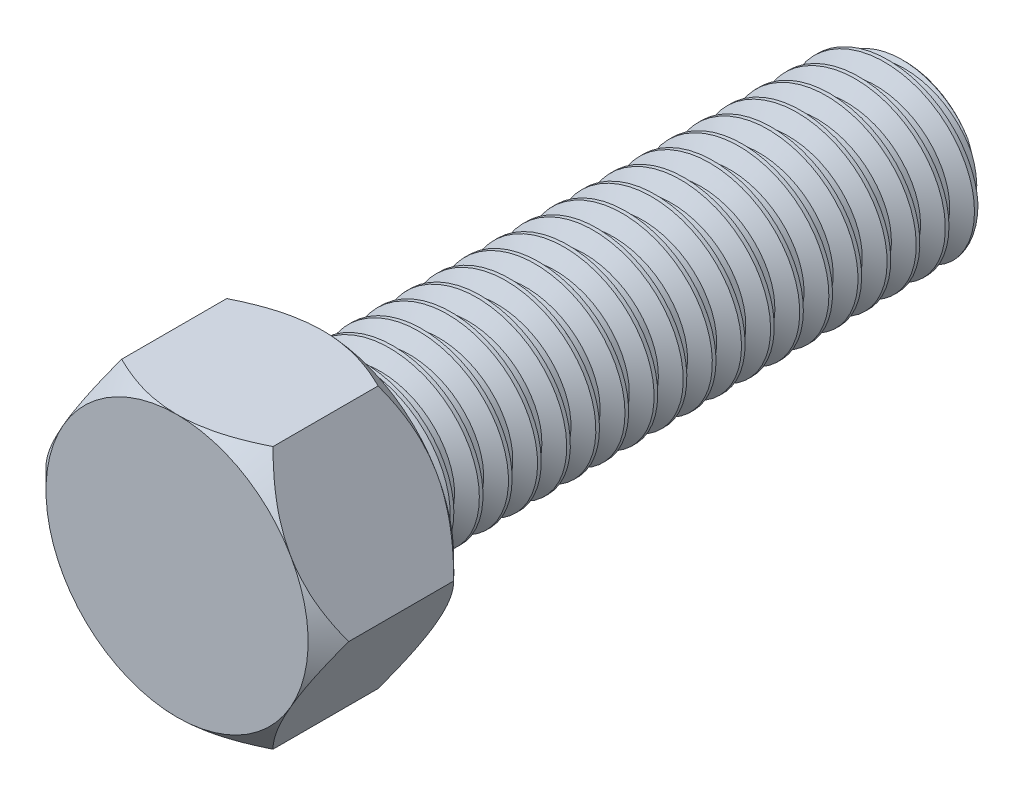
from build123d import *
from build123d.topology import SkipClean

# Parameters (mm, degrees)
BOSS_EXTRUDE1_DEPTH     = 2.5
SKETCH2_OUTSIDE_W       = 34.318
SKETCH2_OUTSIDE_H       = 32.926
SKETCH2_OUTSIDE_R       = 4.5
CUT_EXTRUDE1_DEPTH      = 9.5
CUT_EXTRUDE1_DRAFT      = -45
MIRROR1_COPY_1_SKETCH_W = 34.318
MIRROR1_COPY_1_SKETCH_H = 32.926
MIRROR1_COPY_1_SKETCH_R = 4.5
MIRROR1_COPY_1_DEPTH    = 9.5
MIRROR1_COPY_1_DRAFT    = -45
SKETCH3_R               = 3
BOSS_EXTRUDE2_DEPTH     = 20
CHAMFER1_SIZE           = 0.5
THREAD1_PITCH           = 1
CUT_EXTRUDE2_DEPTH      = 24.526580827


with BuildPart() as part:
    # Sketch1 → Boss-Extrude1 (new, symmetric)
    with BuildSketch(Plane.XY):
        Polygon((2.598076211, 4.5), (-2.598076211, 4.5), (-5.196152423, 0), (-2.598076211, -4.5), (2.598076211, -4.5), (5.196152423, 0), align=None)
    extrude(amount=BOSS_EXTRUDE1_DEPTH, both=True)


with BuildPart() as cut_extrude1_tool:
    # Sketch2 outside → Cut-Extrude1 (with draft: the straight prism first)
    with BuildSketch(Plane.XY.offset(2.5)):
        Rectangle(SKETCH2_OUTSIDE_W, SKETCH2_OUTSIDE_H)
        Circle(SKETCH2_OUTSIDE_R, mode=Mode.SUBTRACT)
    extrude(amount=-CUT_EXTRUDE1_DEPTH)
    # Cut-Extrude1: the draft: its side faces are tilted about the plane it starts from
    cut_extrude1_sides = [cut_extrude1_tool.faces().sort_by_distance(p)[0] for p in [
        (0, -16.463, -2.25),
        (17.159, 0, -2.25),
        (0, 16.463, -2.25),
        (-17.159, 0, -2.25),
        (-4.5, 0, -2.25),
    ]]
    draft(cut_extrude1_sides, Plane.XY.offset(2.5), CUT_EXTRUDE1_DRAFT)


with BuildPart() as part_1:
    add(part.part)

    # Cut-Extrude1: cut by cut_extrude1_tool
    add(cut_extrude1_tool.part, mode=Mode.SUBTRACT)


with BuildPart() as mirror1_copy_1_tool:
    # Mirror1 copy 1 sketch → Mirror1 copy 1 (with draft: the straight prism first)
    with BuildSketch(Plane(origin=(0, 0, -2.5), x_dir=(1, 0, 0), z_dir=(0, 0, -1))):
        Rectangle(MIRROR1_COPY_1_SKETCH_W, MIRROR1_COPY_1_SKETCH_H)
        Circle(MIRROR1_COPY_1_SKETCH_R, mode=Mode.SUBTRACT)
    extrude(amount=-MIRROR1_COPY_1_DEPTH)
    # Mirror1 copy 1: the draft: its side faces are tilted about the plane it starts from
    mirror1_copy_1_sides = [mirror1_copy_1_tool.faces().sort_by_distance(p)[0] for p in [
        (0, -16.463, 2.25),
        (17.159, 0, 2.25),
        (0, 16.463, 2.25),
        (-17.159, 0, 2.25),
        (-4.5, 0, 2.25),
    ]]
    draft(mirror1_copy_1_sides, Plane(origin=(0, 0, -2.5), x_dir=(1, 0, 0), z_dir=(0, 0, -1)), MIRROR1_COPY_1_DRAFT)


with BuildPart() as part_2:
    add(part_1.part)

    # Mirror1 copy 1: cut by mirror1_copy_1_tool
    add(mirror1_copy_1_tool.part, mode=Mode.SUBTRACT)

    # Sketch3 → Boss-Extrude2 (add)
    with BuildSketch(Plane(origin=(0, 0, -2.5), x_dir=(-1, 0, 0), z_dir=(0, 0, -1))):
        with Locations(Location((0, 0, 0), (0, 0, 180))):
            Circle(SKETCH3_R)
    extrude(amount=BOSS_EXTRUDE2_DEPTH)

    # Chamfer1
    chamfer1_edges = [part_2.edges().sort_by_distance(p)[0] for p in [
        (-3, 0, -22.5),
    ]]
    chamfer(chamfer1_edges, length=CHAMFER1_SIZE)

    # Thread1: the profile of Thread Profile1 profile screwed along a right-hand helix of 20 turns, 8 arcs to a turn; built about Z, then put on its axis
    with SkipClean():  # the faces are left unmerged after this step: merging them gives an invalid solid
        thread1_z = Axis((0, 0, 0), (0, 0, 1))
        thread1_corners = [(3.0003, 0, -0.000173205), (3.0003, 0, 0.875173202), (2.458734125, 0, 0.562499999), (2.458734125, 0, 0.312499999)]
        with BuildLine(mode=Mode.PRIVATE) as thread1_profile:
            Line(thread1_corners[0], thread1_corners[1])
            Line(thread1_corners[1], thread1_corners[2])
            Line(thread1_corners[2], thread1_corners[3])
            Line(thread1_corners[3], thread1_corners[0])
        thread1_cap = Face(thread1_profile.wire())
        thread1_turn_angles = [0, 22.5, 45, 67.5, 90, 112.5, 135, 157.5, 180, 202.5, 225, 247.5, 270, 292.5, 315, 337.5, 360]
        thread1_turn_weights = [1, 0.9238795325112867, 1, 0.9238795325112867, 1, 0.9238795325112867, 1, 0.9238795325112867, 1, 0.9238795325112867, 1, 0.9238795325112867, 1, 0.9238795325112867, 1, 0.9238795325112867, 1]
        thread1_turn_rails = [Edge.make_bspline([Vector(p[0], p[1], 0).rotate(thread1_z, thread1_turn_angles[k]) / thread1_turn_weights[k] + Vector(0, 0, p[2] + THREAD1_PITCH * thread1_turn_angles[k] / 360) for k in range(17)], [0, 0, 0, 1, 1, 2, 2, 3, 3, 4, 4, 5, 5, 6, 6, 7, 7, 8, 8, 8], 2, thread1_turn_weights) for p in thread1_corners]
        thread1_turn_sides = [Face.make_surface_from_curves(thread1_turn_rails[p[0]], thread1_turn_rails[p[1]]) for p in [(0, 1), (1, 2), (2, 3), (3, 0)]]
        thread1 = Plane(origin=(0, 0, -2.5), x_dir=(-1, 0, 0), z_dir=(0, 0, -1)) * Solid(Shell([*[p.moved(Location((0, 0, THREAD1_PITCH * i))) for i in range(20) for p in thread1_turn_sides], thread1_cap, thread1_cap.rotate(thread1_z, 7200).moved(Location((0, 0, THREAD1_PITCH * 7200 / 360)))]))
        add(thread1, mode=Mode.SUBTRACT)

    # Sketch8 → Cut-Extrude2 (cut, through all)
    with SkipClean():  # the faces are left unmerged after this step: merging them gives an invalid solid
        with BuildSketch(Plane(origin=(0, 0, 0), x_dir=(1, 0, 0), z_dir=(0, 1, 0))):
            Polygon((-3, 2.5), (-2.458734125, 2.812499999), (-2.458734125, 3.062499999), (-3, 3.374999997), align=None)
        extrude(amount=-CUT_EXTRUDE2_DEPTH, mode=Mode.SUBTRACT)


solid = part_2.part
